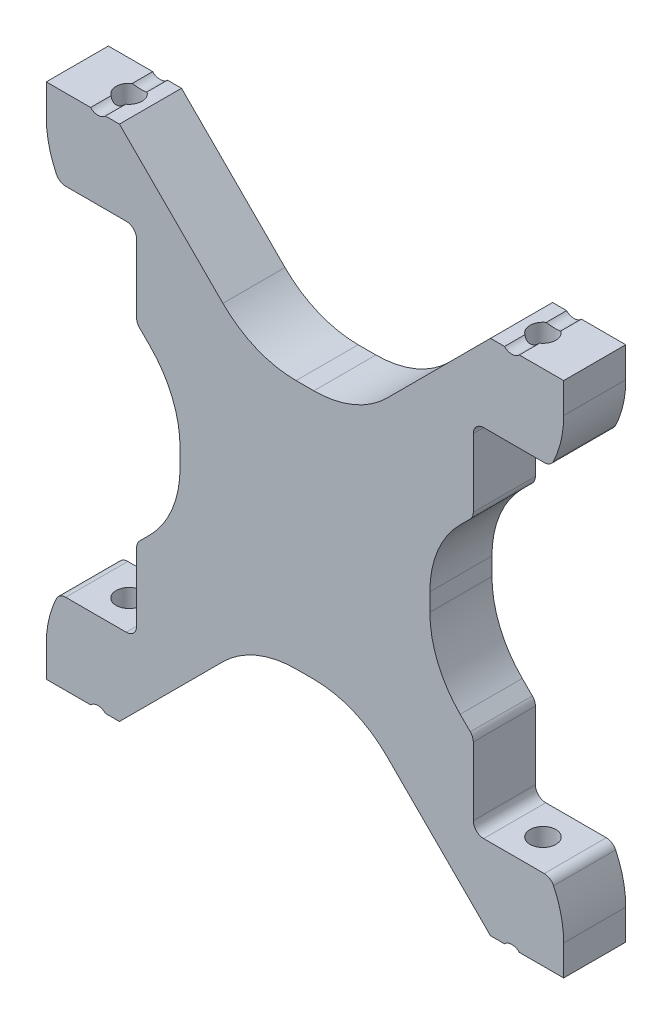
from build123d import *

# Parameters (mm, degrees)
EXTRUDE_1_DEPTH        = 6
CUT_EXTRUDE_1_DEPTH    = 42.104177289
FILLET_1_R             = 2
FILLET_1_OF_MIRROR_3_R = 2
SKETCH_3_R             = 1.25
CUT_EXTRUDE_2_DEPTH    = 59.233427122
SKETCH_4_W             = 4.242640687
SKETCH_4_H             = 50
CUT_EXTRUDE_3_DEPTH    = 39.937540248
FILLET_2_R             = 10
SKETCH_5_W             = 7.463630892
SKETCH_5_H             = 8
CUT_EXTRUDE_4_DEPTH    = 36.860842241
FILLET_3_R             = 1


with BuildPart() as part:
    # ｽｹｯﾁ1 → ﾎﾞｽ - 押し出し1 (new body)
    with BuildSketch(Plane.XY):
        Polygon((-32.071067812, 25), (-12.071067812, 5), (-12.071067812, -5), (-32.071067812, -25), (-17.928932188, -25), (-5, -12.071067812), (5, -12.071067812), (17.928932188, -25), (32.071067812, -25), (12.071067812, -5), (12.071067812, 5), (32.071067812, 25), (17.928932188, 25), (5, 12.071067812), (-5, 12.071067812), (-17.928932188, 25), align=None)
    extrude(amount=EXTRUDE_1_DEPTH)

    # ｽｹｯﾁ2 → ｶｯﾄ - 押し出し1 (cut, through all)
    with BuildSketch(Plane.XY.offset(6)):
        with BuildLine():
            Line((-20.714142843, 25), (-19.285857157, 25))
            ThreePointArc((-19.285857157, 25), (-20, 24.7), (-20.714142843, 25))
        make_face()
        with BuildLine():
            Line((20.714142843, 25), (19.285857157, 25))
            ThreePointArc((19.285857157, 25), (20, 24.7), (20.714142843, 25))
        make_face()
    cut_extrude_1 = extrude(amount=-CUT_EXTRUDE_1_DEPTH, mode=Mode.SUBTRACT)

    # ﾌｨﾚｯﾄ1
    fillet_1_edges = [part.edges().sort_by_distance(p)[0] for p in [
        (32.071067812, 25, 3),
        (-32.071067812, 25, 3),
    ]]
    fillet(fillet_1_edges, radius=FILLET_1_R)

    # ﾐﾗｰ3: ｶｯﾄ - 押し出し1 across plane
    add(cut_extrude_1.mirror(Plane.ZX), mode=Mode.SUBTRACT)

    # ﾌｨﾚｯﾄ1 of ﾐﾗｰ3
    fillet_1_of_mirror_3_edges = [part.edges().sort_by_distance(p)[0] for p in [
        (32.071067812, -25, 3),
        (-32.071067812, -25, 3),
    ]]
    fillet(fillet_1_of_mirror_3_edges, radius=FILLET_1_OF_MIRROR_3_R)

    # ｽｹｯﾁ3 → ｶｯﾄ - 押し出し2 (cut, through all)
    with BuildSketch(Plane(origin=(0, 25, 0), x_dir=(1, 0, 0), z_dir=(0, 1, 0))):
        with Locations((-20, -3)):
            Circle(SKETCH_3_R)
        with Locations((20, -3)):
            Circle(SKETCH_3_R)
    extrude(amount=-CUT_EXTRUDE_2_DEPTH, mode=Mode.SUBTRACT)

    # ｽｹｯﾁ4 → ｶｯﾄ - 押し出し3 (cut, through all)
    with BuildSketch(Plane.XY.offset(6)):
        with Locations((-27.121320344, 0)):
            Rectangle(SKETCH_4_W, SKETCH_4_H)
        with Locations((27.121320344, 0)):
            Rectangle(SKETCH_4_W, SKETCH_4_H)
    extrude(amount=-CUT_EXTRUDE_3_DEPTH, mode=Mode.SUBTRACT)

    # ﾌｨﾚｯﾄ2
    fillet_2_edges = [part.edges().sort_by_distance(p)[0] for p in [
        (25, 17.928932188, 3),
        (12.071067812, 5, 3),
        (12.071067812, -5, 3),
        (25, -17.928932188, 3),
        (5, -12.071067812, 3),
        (-5, -12.071067812, 3),
        (-25, -17.928932188, 3),
        (-12.071067812, -5, 3),
        (-12.071067812, 5, 3),
        (-25, 17.928932188, 3),
        (5, 12.071067812, 3),
        (-5, 12.071067812, 3),
    ]]
    fillet(fillet_2_edges, radius=FILLET_2_R)

    # ｽｹｯﾁ5 → ｶｯﾄ - 押し出し4 (cut, through all)
    with BuildSketch(Plane.XY.offset(6)):
        with Locations((-20, 13.197116743)):
            Rectangle(SKETCH_5_W, SKETCH_5_H)
        with Locations((20, 13.197116743)):
            Rectangle(SKETCH_5_W, SKETCH_5_H)
        with Locations((-20, -13.197116743)):
            Rectangle(SKETCH_5_W, SKETCH_5_H)
        with Locations((20, -13.197116743)):
            Rectangle(SKETCH_5_W, SKETCH_5_H)
    extrude(amount=-CUT_EXTRUDE_4_DEPTH, mode=Mode.SUBTRACT)

    # ﾌｨﾚｯﾄ3
    fillet_3_edges = [part.edges().sort_by_distance(p)[0] for p in [
        (-23.731815446, -17.197116743, 3),
        (-16.268184554, -17.197116743, 3),
        (-16.268184554, -9.197116743, 3),
        (23.731815446, -17.197116743, 3),
        (16.268184554, -9.197116743, 3),
        (16.268184554, -17.197116743, 3),
        (16.268184554, 9.197116743, 3),
        (23.731815446, 17.197116743, 3),
        (16.268184554, 17.197116743, 3),
        (-16.268184554, 9.197116743, 3),
        (-23.731815446, 17.197116743, 3),
        (-16.268184554, 17.197116743, 3),
    ]]
    fillet(fillet_3_edges, radius=FILLET_3_R)


solid = part.part
